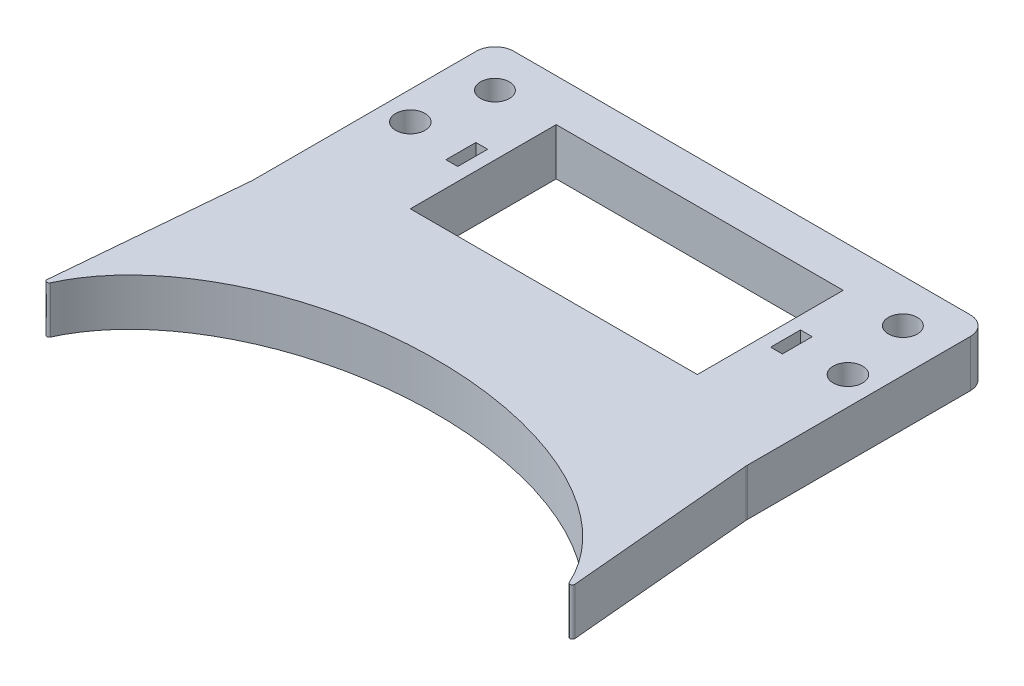
from build123d import *

# Parameters (mm, degrees)
SKETCH1_W           = 105
SKETCH1_H           = 65
BOSS_EXTRUDE1_DEPTH = 10
SKETCH2_W           = 61
SKETCH2_H           = 31
CUT_EXTRUDE1_DEPTH  = 63.549980016
SKETCH4_R           = 3.125
SKETCH4_W           = 2.5
SKETCH4_H           = 6.35
CUT_EXTRUDE3_DEPTH  = 63.549980016
BOSS_EXTRUDE2_DEPTH = 10
SKETCH6_R           = 3.075
CUT_EXTRUDE4_DEPTH  = 85.949986617
FILLET1_R           = 4
FILLET2_R           = 0.5


with BuildPart() as part:
    # Sketch1 → Boss-Extrude1 (new body)
    with BuildSketch(Plane(origin=(0, 0, 0), x_dir=(1, 0, 0), z_dir=(0, 1, 0))):
        Rectangle(SKETCH1_W, SKETCH1_H)
    extrude(amount=BOSS_EXTRUDE1_DEPTH)

    # Sketch2 → Cut-Extrude1 (cut, through all)
    with BuildSketch(Plane(origin=(0, 10, 0), x_dir=(1, 0, 0), z_dir=(0, 1, 0))):
        with Locations((0, 8)):
            Rectangle(SKETCH2_W, SKETCH2_H)
    extrude(amount=-CUT_EXTRUDE1_DEPTH, mode=Mode.SUBTRACT)

    # Sketch4 → Cut-Extrude3 (cut, through all)
    with BuildSketch(Plane(origin=(0, 10, 0), x_dir=(1, 0, 0), z_dir=(0, 1, 0))):
        with Locations(Location((-46.5, 8.5, 0), (0, 0, 270))):
            Circle(SKETCH4_R)
        with Locations((-34.5, 8.5)):
            Rectangle(SKETCH4_W, SKETCH4_H)
    cut_extrude3 = extrude(amount=-CUT_EXTRUDE3_DEPTH, mode=Mode.SUBTRACT)

    # Sketch5 → Boss-Extrude2 (add)
    with BuildSketch(Plane(origin=(0, 0, 0), x_dir=(1, 0, 0), z_dir=(0, 1, 0))):
        with BuildLine():
            Line((0, -32.5), (-52.5, -19.039128985))
            Line((-52.5, -19.039128985), (-56.408079011, -62.726619731))
            add(Edge.make_bspline(
                [(0, -32.5), (-47.244656315, -32.5), (-56.408079011, -62.726619731)],
                knots=[4.71238898, 4.71238898, 4.71238898, 6.087991355, 6.087991355, 6.087991355], degree=2, weights=[1, 0.772643775, 1]))
        make_face()
    boss_extrude2 = extrude(amount=BOSS_EXTRUDE2_DEPTH)

    # Sketch6 → Cut-Extrude4 (cut, through all)
    with BuildSketch(Plane(origin=(0, 10, 0), x_dir=(1, 0, 0), z_dir=(0, 1, 0))):
        with Locations(Location((-43.347709835, 23.330814615, 0), (0, 0, 270))):
            Circle(SKETCH6_R)
    cut_extrude4 = extrude(amount=-CUT_EXTRUDE4_DEPTH, mode=Mode.SUBTRACT)

    # Mirror1: Cut-Extrude3, Boss-Extrude2, Cut-Extrude4 across plane
    add(cut_extrude3.mirror(Plane(origin=(0, 0, 0), x_dir=(0, 0, 1), z_dir=(1, 0, 0))), mode=Mode.SUBTRACT)
    add(boss_extrude2.mirror(Plane(origin=(0, 0, 0), x_dir=(0, 0, 1), z_dir=(1, 0, 0))))
    add(cut_extrude4.mirror(Plane(origin=(0, 0, 0), x_dir=(0, 0, 1), z_dir=(1, 0, 0))), mode=Mode.SUBTRACT)

    # Fillet1
    # the kernel refuses this fillet: 4 mm, written as the material it adds along each edge
    with BuildSketch(Plane(origin=(-52.5, 0, 19.039128985), x_dir=(0, 0, -1), z_dir=(0, 1, 0))) as fillet1_piece_1:
        with BuildLine():
            CenterArc((FILLET1_R * 0.0446385419256, FILLET1_R), FILLET1_R, 264.888193347, 5.111806653)
            Line((-FILLET1_R * 0.0444610022252, FILLET1_R * 0.00397727373713), (0, 0))
            Line((0, 0), (FILLET1_R * 0.0446385419256, 0))
        make_face()
    extrude(amount=10)
    with BuildSketch(Plane(origin=(52.5, 0, 19.039128985), x_dir=(0, 0, -1), z_dir=(0, 1, 0))) as fillet1_piece_2:
        with BuildLine():
            CenterArc((FILLET1_R * 0.0446385419256, -FILLET1_R), FILLET1_R, 90, 5.111806653)
            Line((-FILLET1_R * 0.0444610022252, -FILLET1_R * 0.00397727373713), (0, 0))
            Line((0, 0), (FILLET1_R * 0.0446385419256, 0))
        make_face()
    extrude(amount=10)
    # the kernel refuses this fillet: 4 mm, written as the material it takes off along each edge
    with BuildSketch(Plane(origin=(-52.5, -10, -32.5), x_dir=(0, 0, 1), z_dir=(0, 1, 0)), Plane(origin=(52.5, -10, -32.5), x_dir=(-1, 0, 0), z_dir=(0, 1, 0))) as fillet1_2_piece_1:
        with BuildLine():
            CenterArc((FILLET1_R, FILLET1_R), FILLET1_R, 180, 90)
            Line((0, FILLET1_R), (0, 0))
            Line((0, 0), (FILLET1_R, 0))
        make_face()
    extrude(amount=30, mode=Mode.SUBTRACT)

    # Fillet2
    fillet2_edges = [part.edges().sort_by_distance(p)[0] for p in [
        (56.408079011, 5, 62.726619731),
        (-56.408079011, 5, 62.726619731),
    ]]
    fillet(fillet2_edges, radius=FILLET2_R)


solid = part.part
